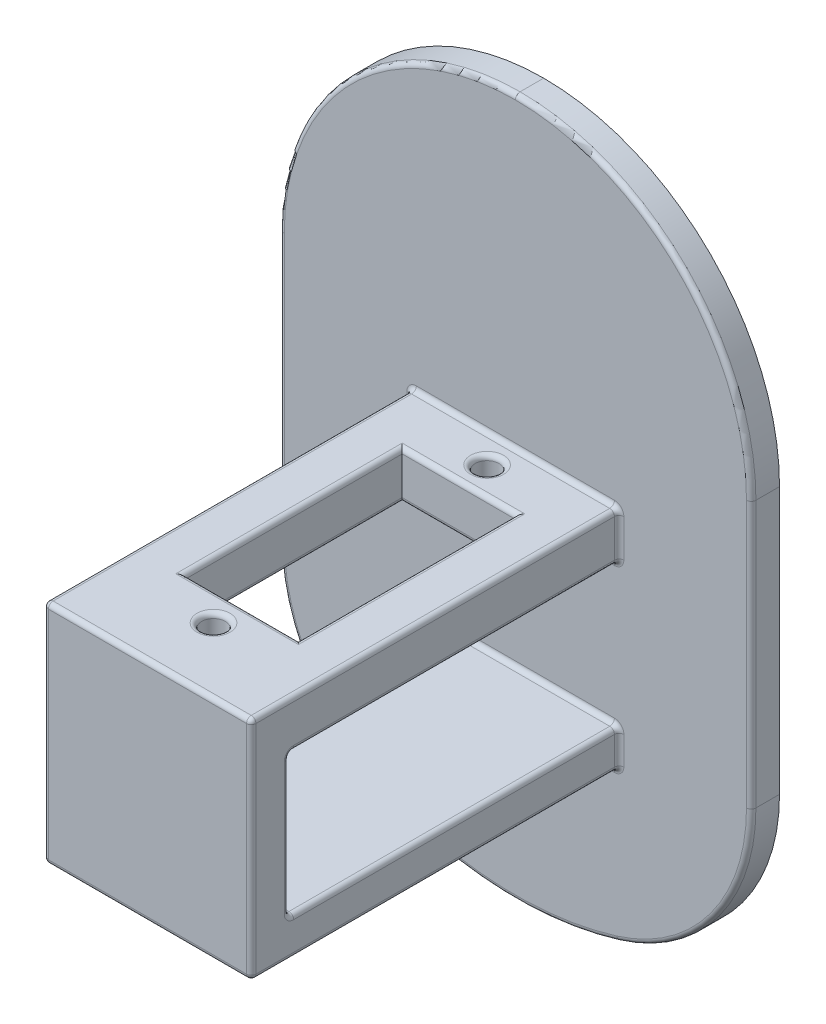
from build123d import *

# Parameters (mm, degrees)
SKETCH1_R           = 37
BOSS_EXTRUDE1_DEPTH = 3
CUT_EXTRUDE3_START  = -10
CUT_EXTRUDE3_DEPTH  = 10
FILLET1_R           = 25
FILLET2_R           = 20
SKETCH4_W           = 22
SKETCH4_H           = 5
BOSS_EXTRUDE2_DEPTH = 35
SKETCH5_W           = 12
SKETCH5_H           = 23
CUT_EXTRUDE1_DEPTH  = 5
SKETCH6_R           = 1.25
CUT_EXTRUDE2_DEPTH  = 5
SKETCH7_W           = 22
SKETCH7_H           = 20
BOSS_EXTRUDE3_DEPTH = 4
SKETCH8_W           = 22
SKETCH8_H           = 39
BOSS_EXTRUDE4_DEPTH = 4
SKETCH9_R           = 3.75
BOSS_EXTRUDE5_DEPTH = 7
FILLET3_R           = 0.5


with BuildPart() as part:
    # Sketch1 → Boss-Extrude1 (new body)
    with BuildSketch(Plane.XY):
        Circle(SKETCH1_R)
    extrude(amount=BOSS_EXTRUDE1_DEPTH)

    # Sketch10 → Cut-Extrude3 (cut)
    with BuildSketch(Plane.XY.offset(3).offset(CUT_EXTRUDE3_START)):
        with BuildLine():
            Line((-25, 27.276363394), (-25, -27.276363394))
            ThreePointArc((-25, -27.276363394), (-37, 0), (-25, 27.276363394))
        make_face()
        with BuildLine():
            Line((25, -27.276363394), (25, 27.276363394))
            ThreePointArc((25, 27.276363394), (37, 0), (25, -27.276363394))
        make_face()
    extrude(amount=CUT_EXTRUDE3_DEPTH, mode=Mode.SUBTRACT)

    # Fillet1
    fillet1_edges = [part.edges().sort_by_distance(p)[0] for p in [
        (-25, 27.276363394, 1.5),
        (25, 27.276363394, 1.5),
    ]]
    fillet(fillet1_edges, radius=FILLET1_R - 0.0001)  # a hair under: the kernel refuses the full size

    # Fillet2
    fillet2_edges = [part.edges().sort_by_distance(p)[0] for p in [
        (-25, -27.276363394, 1.5),
        (25, -27.276363394, 1.5),
    ]]
    fillet(fillet2_edges, radius=FILLET2_R)

    # Sketch4 → Boss-Extrude2 (add)
    with BuildSketch(Plane.XY.offset(3)):
        with Locations((0, 2)):
            Rectangle(SKETCH4_W, SKETCH4_H)
    extrude(amount=BOSS_EXTRUDE2_DEPTH)

    # Sketch5 → Cut-Extrude1 (cut)
    with BuildSketch(Plane(origin=(0, 4.5, 0), x_dir=(1, 0, 0), z_dir=(0, 1, 0))):
        with Locations((0, -20.5)):
            Rectangle(SKETCH5_W, SKETCH5_H)
    extrude(amount=-CUT_EXTRUDE1_DEPTH, mode=Mode.SUBTRACT)

    # Sketch6 → Cut-Extrude2 (cut)
    with BuildSketch(Plane(origin=(0, 4.5, 0), x_dir=(1, 0, 0), z_dir=(0, 1, 0))):
        with Locations(Location((0, -6, 0), (0, 0, 270))):
            Circle(SKETCH6_R)
        with Locations(Location((0, -35, 0), (0, 0, 270))):
            Circle(SKETCH6_R)
    extrude(amount=-CUT_EXTRUDE2_DEPTH, mode=Mode.SUBTRACT)

    # Sketch7 → Boss-Extrude3 (add)
    with BuildSketch(Plane.XY.offset(38)):
        with Locations((0, -5.5)):
            Rectangle(SKETCH7_W, SKETCH7_H)
    extrude(amount=BOSS_EXTRUDE3_DEPTH)

    # Sketch8 → Boss-Extrude4 (add)
    with BuildSketch(Plane.XZ.offset(15.5)):
        with Locations((0, 22.5)):
            Rectangle(SKETCH8_W, SKETCH8_H)
    extrude(amount=BOSS_EXTRUDE4_DEPTH)

    # Sketch9 → Boss-Extrude5 (add)
    with BuildSketch(Plane.XZ.offset(19.5)):
        with Locations(Location((0, 25.5, 0), (0, 0, 270))):
            Circle(SKETCH9_R)
    extrude(amount=BOSS_EXTRUDE5_DEPTH)

    # Fillet3
    fillet3_edges = [part.edges().sort_by_distance(p)[0] for p in [
        (-11, -15.5, 20.5),
        (0, -15.5, 3),
        (-11, -17.5, 3),
        (11, -15.5, 20.5),
        (11, -17.5, 3),
        (-11, -19.5, 22.5),
        (0, -19.5, 3),
        (11, -19.5, 22.5),
        (0, -19.5, 42),
        (0, -19.5, 29.25),
        (0, -26.5, 29.25),
        (25, -2.123988405, 3),
        (17.677772475, 29.677625162, 3),
        (-17.677772475, 29.677625162, 3),
        (-25, -2.123988405, 3),
        (0, -37, 3),
        (21.087993331, -28.129847325, 3),
        (-21.087993331, -28.129847325, 3),
        (11, 2, 3),
        (11, -0.5, 20.5),
        (0, 4.5, 3),
        (11, 4.5, 22.5),
        (-11, 2, 3),
        (-11, 4.5, 22.5),
        (0, -0.5, 3),
        (-11, -0.5, 20.5),
        (0, -0.5, 38),
        (6, -0.5, 20.5),
        (0, -0.5, 32),
        (-6, -0.5, 20.5),
        (0, -0.5, 9),
        (6, 4.5, 20.5),
        (0, 4.5, 9),
        (-6, 4.5, 20.5),
        (0, 4.5, 32),
        (0, -0.5, 4.75),
        (0, 4.5, 4.75),
        (0, -0.5, 33.75),
        (0, 4.5, 33.75),
        (-11, -8, 38),
        (0, -15.5, 38),
        (11, -8, 38),
        (-11, -7.5, 42),
        (11, -7.5, 42),
        (0, 4.5, 42),
    ]]
    fillet(fillet3_edges, radius=FILLET3_R)


solid = part.part
